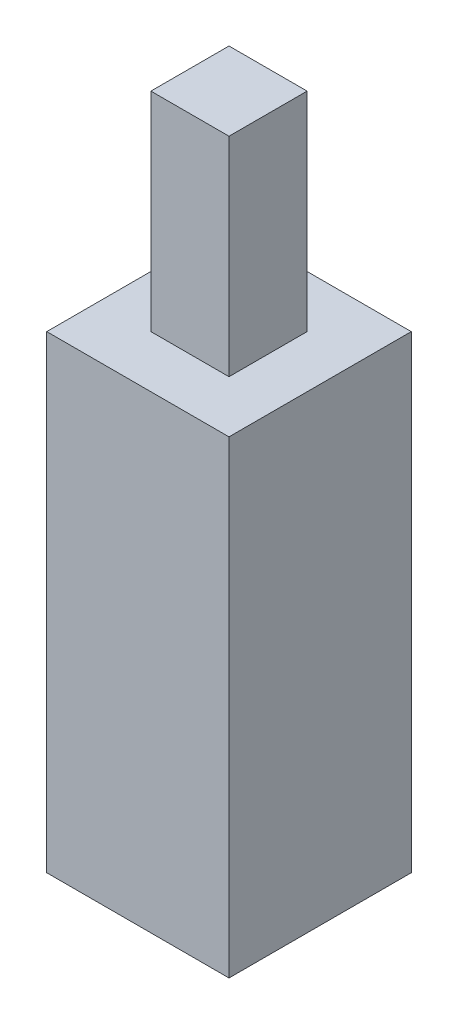
from build123d import *

# Parameters (mm, degrees)
SKETCH1_W           = 7
SKETCH1_H           = 7
BOSS_EXTRUDE1_DEPTH = 18
SKETCH2_W           = 3
SKETCH2_H           = 3
BOSS_EXTRUDE2_DEPTH = 8
SKETCH3_W           = 5
SKETCH3_H           = 2.65
CUT_EXTRUDE1_DEPTH  = 1


with BuildPart() as part:
    # Sketch1 → Boss-Extrude1 (new body)
    with BuildSketch(Plane(origin=(0, 0, 0), x_dir=(1, 0, 0), z_dir=(0, 1, 0))):
        with Locations((3.5, 3.5)):
            Rectangle(SKETCH1_W, SKETCH1_H)
    extrude(amount=BOSS_EXTRUDE1_DEPTH)

    # Sketch2 → Boss-Extrude2 (add)
    with BuildSketch(Plane(origin=(0, 18, 0), x_dir=(1, 0, 0), z_dir=(0, 1, 0))):
        with Locations((3.5, 3.5)):
            Rectangle(SKETCH2_W, SKETCH2_H)
    extrude(amount=BOSS_EXTRUDE2_DEPTH)

    # Sketch3 → Cut-Extrude1 (cut)
    with BuildSketch(Plane(origin=(0, 0, 0), x_dir=(-1, 0, 0), z_dir=(0, -1, 0))):
        with Locations((-3.5, 3.5)):
            Rectangle(SKETCH3_W, SKETCH3_H)
    extrude(amount=-CUT_EXTRUDE1_DEPTH, mode=Mode.SUBTRACT)


solid = part.part
